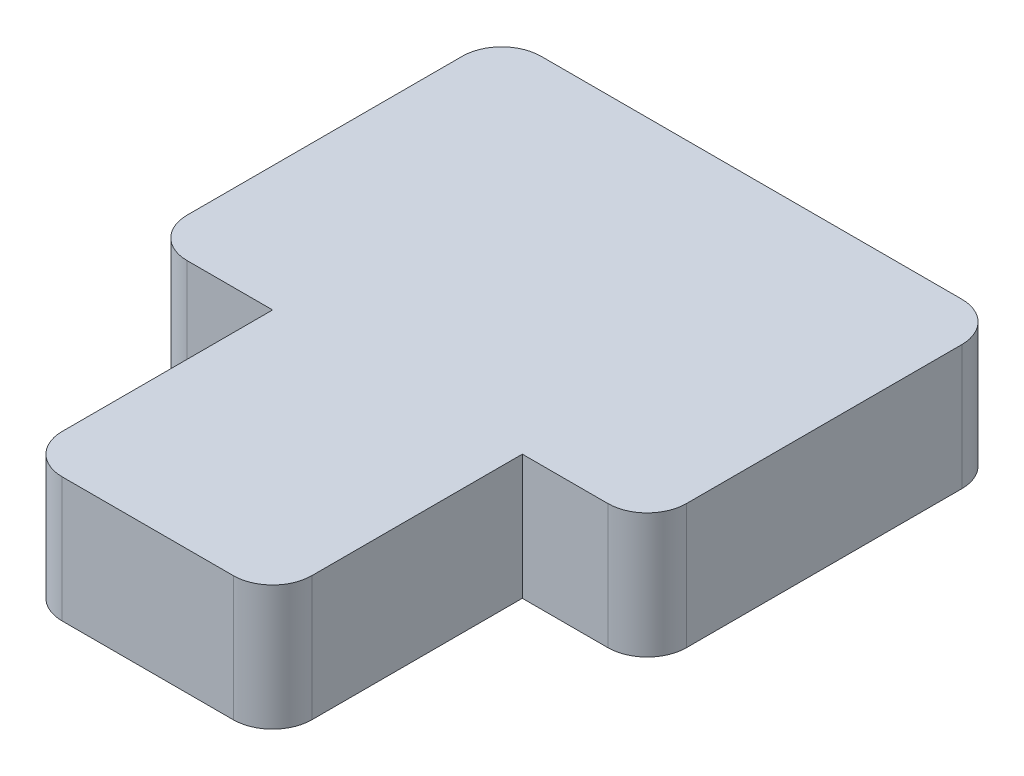
from build123d import *

# Parameters (mm, degrees)
MOTORSUPPORT_EXTRUDE_DEPTH  = 3.175
MOTORSUPPORT_BOTTOMFILLET_R = 1


with BuildPart() as part:
    # Sketch1 → MotorSupport_Extrude (new body)
    with BuildSketch(Plane(origin=(0, 0, 0), x_dir=(1, 0, 0), z_dir=(0, 1, 0))):
        Polygon((0, 0), (6.35, 0), (6.35, 6.35), (9.525, 6.35), (9.525, 15.35), (-3.175, 15.35), (-3.175, 6.35), (0, 6.35), align=None)
    extrude(amount=MOTORSUPPORT_EXTRUDE_DEPTH)

    # MotorSupport_BottomFillet
    motorsupport_bottomfillet_edges = [part.edges().sort_by_distance(p)[0] for p in [
        (0, 1.5875, 0),
        (6.35, 1.5875, 0),
        (-3.175, 1.5875, -15.35),
        (-3.175, 1.5875, -6.35),
        (9.525, 1.5875, -6.35),
        (9.525, 1.5875, -15.35),
    ]]
    fillet(motorsupport_bottomfillet_edges, radius=MOTORSUPPORT_BOTTOMFILLET_R)


solid = part.part
